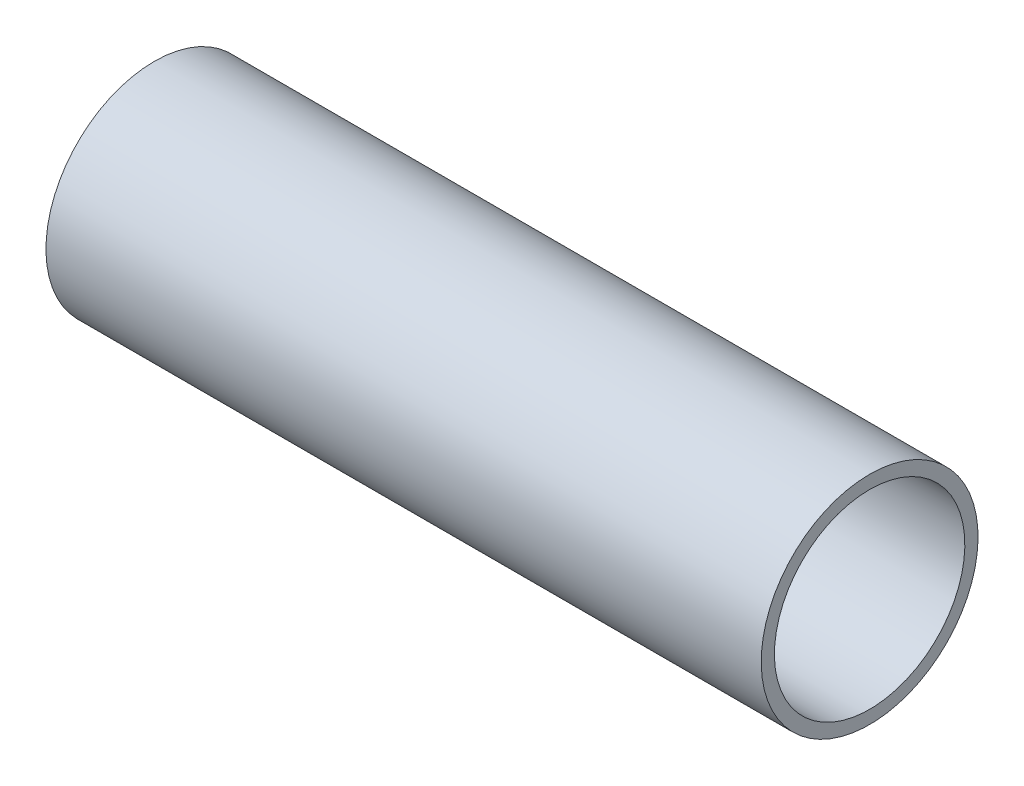
from build123d import *

# Parameters (mm, degrees)
SKETCH1_W = 160
SKETCH1_H = 2.95


with BuildPart() as part:
    # Sketch1 → Revolve1 (revolve)
    with BuildSketch(Plane.XY):
        with Locations((52.5, 22.775)):
            Rectangle(SKETCH1_W, SKETCH1_H)
    revolve(axis=Axis((27.5, 0, 0), (-1, 0, 0)))


solid = part.part
